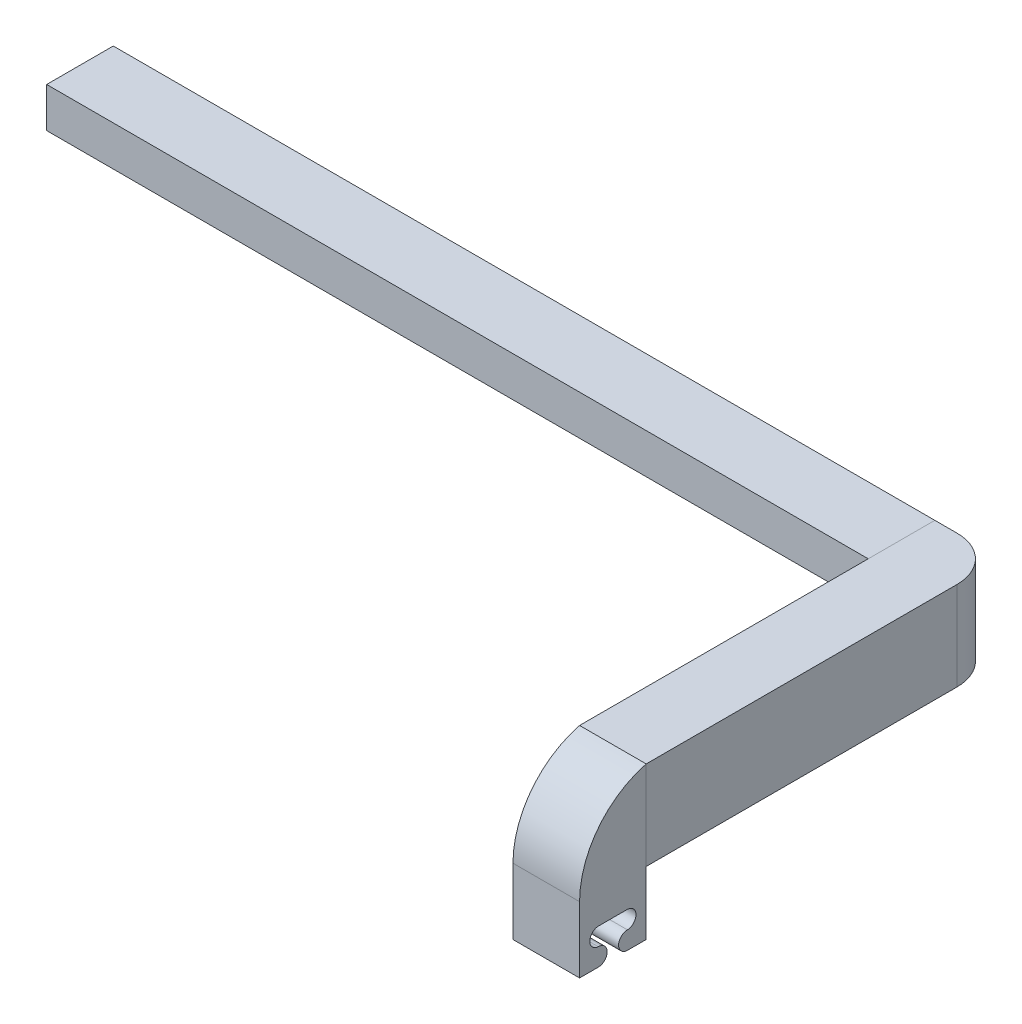
from build123d import *

# Parameters (mm, degrees)
PUSHER_BASE_DEPTH   = 15
SKETCH3_R           = 1.95
SCREW_HOLE_DEPTH    = 7.5
SKETCH6_W           = 7.5
SKETCH6_H           = 30.25
PUSHER_HEAD_DEPTH   = 3.75
FILLET1_R           = 2
CUT_EXTRUDE1_DEPTH  = 7.5
SKETCH9_W           = 40
SKETCH9_H           = 10
BOSS_EXTRUDE1_DEPTH = 7.5
SKETCH10_W          = 92.5
SKETCH10_H          = 4.5
BOSS_EXTRUDE2_DEPTH = 7.5
FILLET7_R           = 10
FILLET8_R           = 5
SKETCH13_W          = 41.9274774
SKETCH13_H          = 25.253149212
CUT_EXTRUDE2_DEPTH  = 26


with BuildPart() as part:
    # Sketch1 → pusher base (new body)
    with BuildSketch(Plane.XY):
        Polygon((59.166899441, -45.877477752), (51.666899441, -45.877477752), (44.666899441, -45.877477752), (37.166899441, -45.877477752), (37.166899441, -69.377477752), (41.916899441, -69.377477752), (41.916899441, -64.127477752), (54.416899441, -64.127477752), (54.416899441, -69.377477752), (59.166899441, -69.377477752), align=None)
        with BuildLine():
            Line((48.279417247, -51.877477752), (48.054381634, -51.877477752))
            ThreePointArc((48.054381634, -51.877477752), (39.166899441, -50.877477752), (48.054381634, -49.877477752))
            Line((48.054381634, -49.877477752), (48.279417247, -49.877477752))
            ThreePointArc((48.279417247, -49.877477752), (57.166899441, -50.877477752), (48.279417247, -51.877477752))
        make_face(mode=Mode.SUBTRACT)
    extrude(amount=PUSHER_BASE_DEPTH)

    # Sketch3 → screw hole (cut)
    with BuildSketch(Plane.XZ.offset(64.127477752)):
        with Locations(Location((48.166899441, 7.5, 0), (0, 0, 270))):
            Circle(SKETCH3_R)
    extrude(amount=-SCREW_HOLE_DEPTH, mode=Mode.SUBTRACT)

    # Sketch6 → pusher head (add, symmetric)
    with BuildSketch(Plane.XY.offset(7.5)):
        with Locations((48.166899441, -30.752477752)):
            Rectangle(SKETCH6_W, SKETCH6_H)
    extrude(amount=PUSHER_HEAD_DEPTH, both=True)

    # Fillet1
    # the kernel refuses this fillet: 2 mm, written as the material it takes off along each edge
    with BuildSketch(Plane(origin=(64.166899441, -45.877477752, 0), x_dir=(0, -1, 0), z_dir=(-1, 0, 0)), Plane(origin=(32.166899441, -45.877477752, 15), x_dir=(0, -1, 0), z_dir=(1, 0, 0))) as fillet1_piece_1:
        with BuildLine():
            CenterArc((FILLET1_R, FILLET1_R), FILLET1_R, 180, 90)
            Line((0, FILLET1_R), (0, 0))
            Line((0, 0), (FILLET1_R, 0))
        make_face()
    extrude(amount=32, mode=Mode.SUBTRACT)

    # Sketch12 → Cut-Extrude1 (cut)
    with BuildSketch(Plane.ZY.offset(-44.416899441)):
        with BuildLine():
            ThreePointArc((5.858454214, -30.752477752), (6.858454214, -31.752477752), (5.858454214, -32.752477752))
            Line((5.858454214, -32.752477752), (3.75, -32.752477752))
            Line((3.75, -32.752477752), (3.75, -45.877477752))
            Line((3.75, -45.877477752), (11.25, -45.877477752))
            Line((11.25, -45.877477752), (11.25, -32.752477752))
            Line((11.25, -32.752477752), (9.141545786, -32.752477752))
            ThreePointArc((9.141545786, -32.752477752), (8.141545786, -31.752477752), (9.141545786, -30.752477752))
            ThreePointArc((9.141545786, -30.752477752), (10.09823306, -29.752477752), (9.141545786, -28.752477752))
            Line((9.141545786, -28.752477752), (5.858454214, -28.752477752))
            ThreePointArc((5.858454214, -28.752477752), (4.90176694, -29.752477752), (5.858454214, -30.752477752))
        make_face()
    extrude(amount=-CUT_EXTRUDE1_DEPTH, mode=Mode.SUBTRACT)


with BuildPart() as cut_extrude1_piece_1:
    # of the separate pieces the step leaves, piece 1, a body of its own (cut_extrude1_pieces)
    add(part.part.solids().sort_by_distance((54.416899441, -69.377477752, 0))[0])

    # Sketch13 → Cut-Extrude2 (cut)
    with BuildSketch(Plane(origin=(0, -45.877477752, 0), x_dir=(1, 0, 0), z_dir=(0, 1, 0))):
        with Locations((48.381862236, -7.484888467)):
            Rectangle(SKETCH13_W, SKETCH13_H)
    extrude(amount=-CUT_EXTRUDE2_DEPTH, mode=Mode.SUBTRACT)


with BuildPart() as cut_extrude1_piece_2:
    # of the separate pieces the step leaves, piece 2, a body of its own (cut_extrude1_pieces)
    add(part.part.solids().sort_by_distance((51.916899441, -15.627477752, 3.75))[0])

    # Fillet7
    # the kernel refuses this fillet: 10 mm, written as the material it takes off along each edge
    with BuildSketch(Plane(origin=(76.123045355, -15.627477752, 11.25), x_dir=(0, 0, -1), z_dir=(-1, 0, 0))) as fillet7_piece_1:
        with BuildLine():
            CenterArc((10, 9.682458366), FILLET7_R, 180, 75.522487814)
            Line((0, 9.682458366), (-0.2, 9.682458366))
            Line((-0.2, 9.682458366), (-0.2, 0))
            Line((-0.2, 0), (0, -0.2))
            ThreePointArc((0, -0.2), (3.75, -0.2), (7.45, -0.193649167))
            Line((7.45, -0.193649167), (7.5, 0))
        make_face()
    extrude(amount=55.912291828, mode=Mode.SUBTRACT)


with BuildPart() as body_3:
    # Sketch9 → Boss-Extrude1 (new body)
    with BuildSketch(Plane(origin=(51.916899441, 0, 0), x_dir=(0, 0, -1), z_dir=(1, 0, 0))):
        with Locations((16.25, -20.627477752)):
            Rectangle(SKETCH9_W, SKETCH9_H)
    extrude(amount=-BOSS_EXTRUDE1_DEPTH)

    # Fillet8
    fillet8_edges = [body_3.edges().sort_by_distance(p)[0] for p in [
        (51.916899441, -20.627477752, -36.25),
    ]]
    fillet(fillet8_edges, radius=FILLET8_R)


with BuildPart() as body_4:
    # Sketch10 → Boss-Extrude2 (new body)
    with BuildSketch(Plane(origin=(0, 0, -36.25), x_dir=(-1, 0, 0), z_dir=(0, 0, -1))):
        with Locations((1.833100559, -17.877477752)):
            Rectangle(SKETCH10_W, SKETCH10_H)
    extrude(amount=-BOSS_EXTRUDE2_DEPTH)


solid = Compound([cut_extrude1_piece_2.part, body_3.part, body_4.part])
